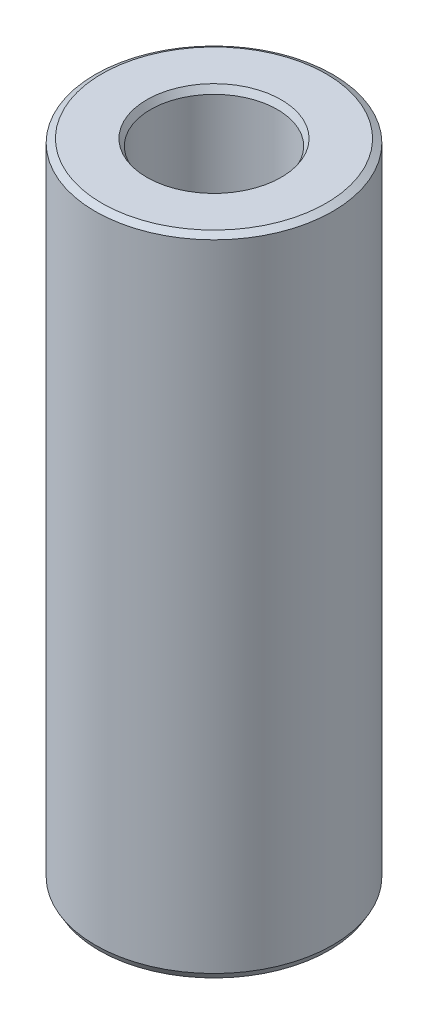
from build123d import *
from OCP.BRepFilletAPI import BRepFilletAPI_MakeChamfer

# Parameters (mm, degrees)
SKETCH1_R           = 57.5
BOSS_EXTRUDE1_DEPTH = 312.789091537
SKETCH2_R           = 30.727468604
CUT_EXTRUDE1_DEPTH  = 324.186503097
CHAMFER1_SIZE       = 1.84519317
CHAMFER1_SIZE2      = 3.179993549


with BuildPart() as part:
    # Sketch1 → Boss-Extrude1 (new body)
    with BuildSketch(Plane(origin=(0, 0, 0), x_dir=(1, 0, 0), z_dir=(0, 1, 0))):
        Circle(SKETCH1_R)
    extrude(amount=BOSS_EXTRUDE1_DEPTH)

    # Sketch2 → Cut-Extrude1 (cut, through all)
    with BuildSketch(Plane(origin=(0, 0, 0), x_dir=(1, 0, 0), z_dir=(0, 1, 0))):
        Circle(SKETCH2_R)
    extrude(amount=CUT_EXTRUDE1_DEPTH, mode=Mode.SUBTRACT)

    # Chamfer1: one chamfer whose edges measure the first distance from different faces: ONE call of the kernel's chamfer builder (chamfer() names one face for all edges)
    chamfer1_edges_1 = [part.edges().sort_by_distance(p)[0] for p in [
        (-30.727468604, 312.789091537, 0),
    ]]
    chamfer1_side_1 = [part.faces().sort_by_distance(p)[0] for p in [
        (-55.873654403, 312.789091537, 0),
    ]]
    chamfer1_edges_2 = [part.edges().sort_by_distance(p)[0] for p in [
        (-30.727468604, 0, 0),
    ]]
    chamfer1_side_2 = [part.faces().sort_by_distance(p)[0] for p in [
        (-30.727468604, 156.394545768, 0),
    ]]
    chamfer1_edges_3 = [part.edges().sort_by_distance(p)[0] for p in [
        (-57.5, 0, 0),
    ]]
    chamfer1_side_3 = [part.faces().sort_by_distance(p)[0] for p in [
        (-55.873654403, 0, 0),
    ]]
    chamfer1_edges_4 = [part.edges().sort_by_distance(p)[0] for p in [
        (-57.5, 312.789091537, 0),
    ]]
    chamfer1_side_4 = [part.faces().sort_by_distance(p)[0] for p in [
        (-57.5, 156.394545768, 0),
    ]]
    chamfer1 = BRepFilletAPI_MakeChamfer(part.part.solid().wrapped)
    for e in chamfer1_edges_1:
        chamfer1.Add(CHAMFER1_SIZE, CHAMFER1_SIZE2, e.wrapped, chamfer1_side_1[0].wrapped)  # the first distance lies on this face
    for e in chamfer1_edges_2:
        chamfer1.Add(CHAMFER1_SIZE, CHAMFER1_SIZE2, e.wrapped, chamfer1_side_2[0].wrapped)  # the first distance lies on this face
    for e in chamfer1_edges_3:
        chamfer1.Add(CHAMFER1_SIZE, CHAMFER1_SIZE2, e.wrapped, chamfer1_side_3[0].wrapped)  # the first distance lies on this face
    for e in chamfer1_edges_4:
        chamfer1.Add(CHAMFER1_SIZE, CHAMFER1_SIZE2, e.wrapped, chamfer1_side_4[0].wrapped)  # the first distance lies on this face
    add(Compound.cast(chamfer1.Shape()), mode=Mode.REPLACE)


solid = part.part
